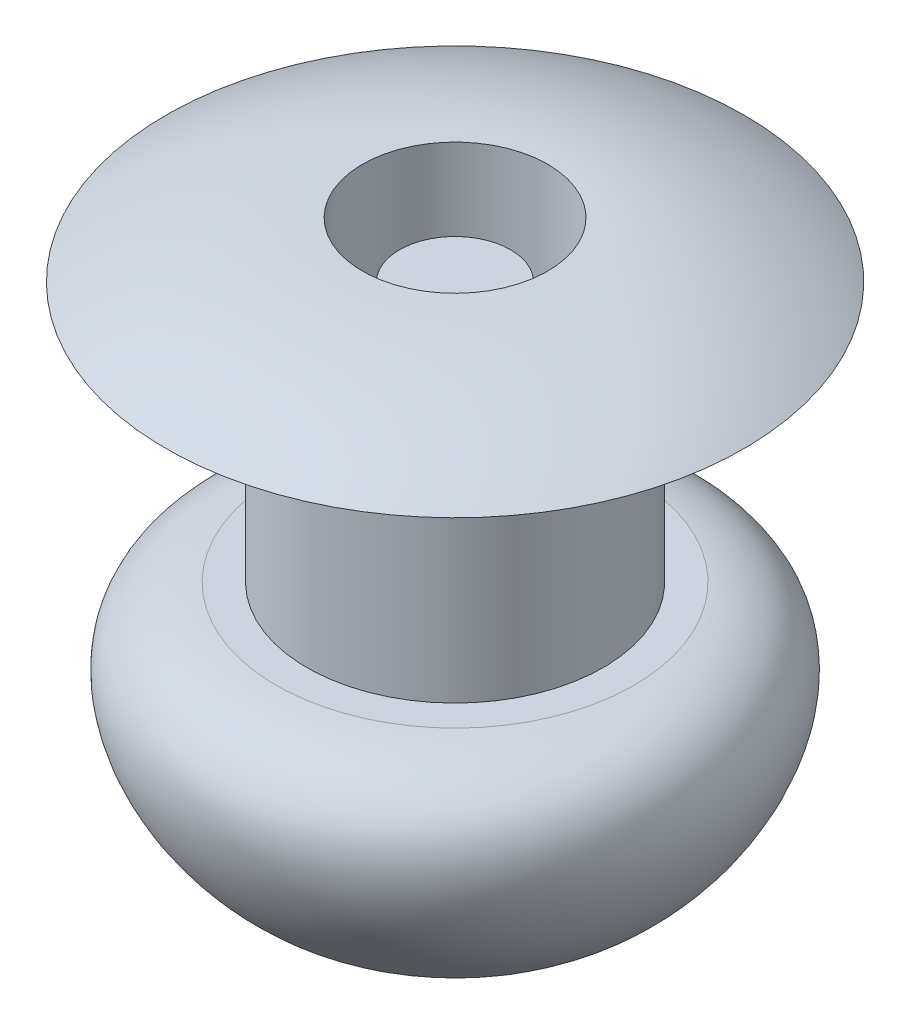
from build123d import *


with BuildPart() as part:
    # Szkic1 → Obrót1 (revolve)
    with BuildSketch(Plane(origin=(0, 0, 0), x_dir=(0, 0, -1), z_dir=(1, 0, 0))):
        with BuildLine():
            Line((0, 0), (-0.75, 0))
            Line((-0.75, 0), (-0.75, -3.710294783))
            Line((-0.75, -3.710294783), (-1.25, -3.710294783))
            Line((-1.25, -3.710294783), (-1.25, 0.75))
            ThreePointArc((-1.25, 0.75), (-2.627043935, 0.558888572), (-3.9, 0))
            Line((-3.9, 0), (-2, 0))
            Line((-2, 0), (-2, -3.50955626))
            Line((-2, -3.50955626), (-2.413891755, -3.50955626))
            add(Edge.make_bspline(
                [(-2.413891755, -3.50955626), (-3.867503112, -3.679213582), (-3.528877649, -5.811569887), (-1.083961642, -7.383088629), (-0.271752618, -5.384505558), (-0.956030427, -5.088485454)],
                knots=[0, 0, 0, 0, 0.464993082, 0.721927553, 1, 1, 1, 1], degree=3))
            add(Edge.make_bspline(
                [(-0.956030427, -5.088485454), (-0.520263876, -5.210294783), (0, -5.210294783)],
                knots=[4.134444875, 4.134444875, 4.134444875, 4.71238898, 4.71238898, 4.71238898], degree=2, weights=[1, 0.958537313, 1]))
            Line((0, -5.210294783), (0, -3.710294783))
            Line((0, -3.710294783), (0, 0))
        make_face()
    revolve(axis=Axis((0, 0, 0), (0, 1, 0)))


solid = part.part
